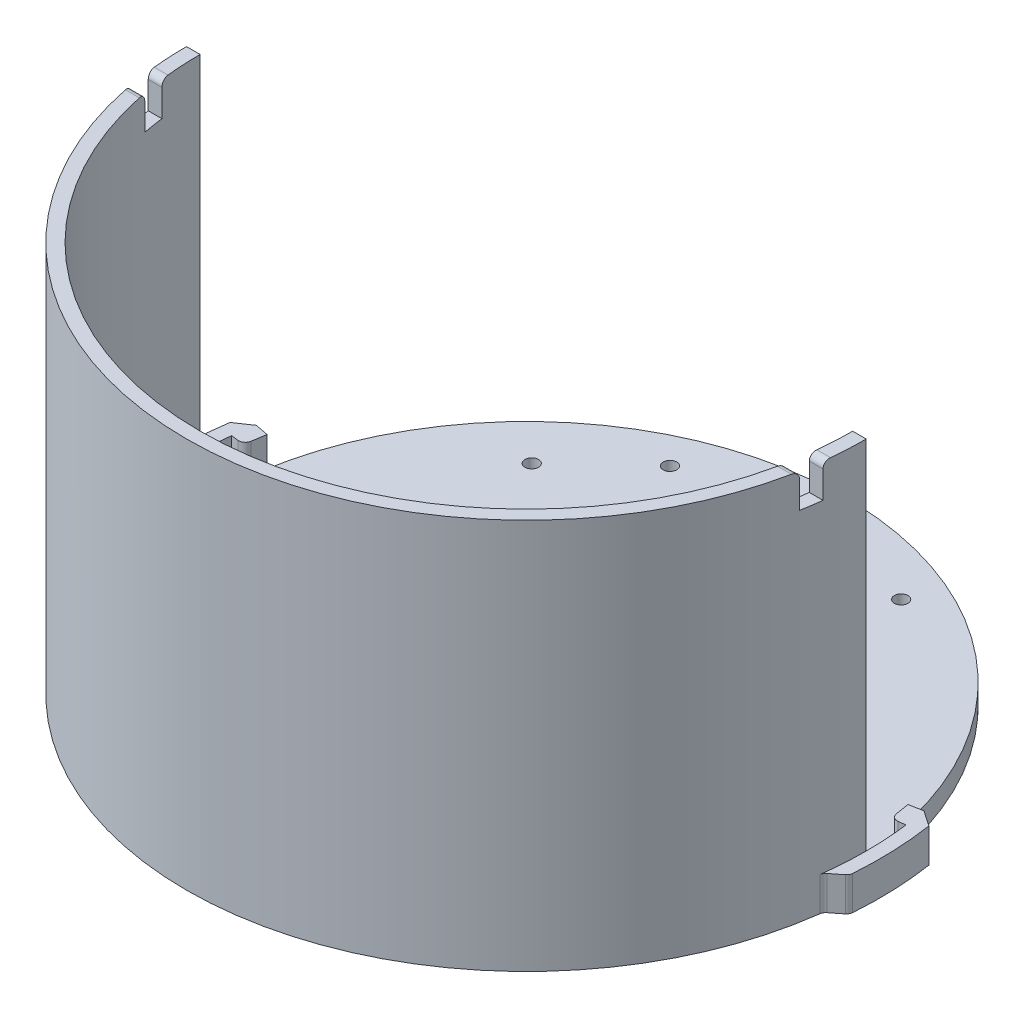
from build123d import *

# Parameters (mm, degrees)
A_BASE_T_START         = -1.5
A_BASE_T_OUTLINE_R     = 47
A_BASE_T_OUTLINE_R_2   = 1
A_BASE_T_DEPTH         = 3
SHELL_BODY_DEPTH       = 57.5
SKETCH3_W              = 2.489993647
SKETCH3_H              = 3
CLIP_CAVITY_DEPTH      = 5
CLIP_DEPTH             = 5
TOP_CLAMP_DEPTH        = 5
CLIP_CHAMFER_SIZE      = 2
CONTOURING_R           = 1
INTERFACE_CONTOURING_R = 2


with BuildPart() as part:
    # a_base_t: read off the stored shape, not the designer's step
    # a_base_t outline → a_base_t (new body)
    with BuildSketch(Plane(origin=(0, 0, 0), x_dir=(1, 0, 0), z_dir=(0, 1, 0)).offset(A_BASE_T_START)):
        Circle(A_BASE_T_OUTLINE_R)
        with Locations((-17.009259258, -38.128042167)):
            Circle(A_BASE_T_OUTLINE_R_2, mode=Mode.SUBTRACT)
        with Locations((-9.166666665, -28.284271247)):
            Circle(A_BASE_T_OUTLINE_R_2, mode=Mode.SUBTRACT)
        with Locations((17.009259258, -38.128042167)):
            Circle(A_BASE_T_OUTLINE_R_2, mode=Mode.SUBTRACT)
        with Locations((27.5, -28.284271247)):
            Circle(A_BASE_T_OUTLINE_R_2, mode=Mode.SUBTRACT)
        with Locations((-27.5, 28.284271247)):
            Circle(A_BASE_T_OUTLINE_R_2, mode=Mode.SUBTRACT)
        with Locations((-17.009259258, 38.128042167)):
            Circle(A_BASE_T_OUTLINE_R_2, mode=Mode.SUBTRACT)
        with Locations((9.166666665, 28.284271247)):
            Circle(A_BASE_T_OUTLINE_R_2, mode=Mode.SUBTRACT)
        with Locations((17.009259258, 38.128042167)):
            Circle(A_BASE_T_OUTLINE_R_2, mode=Mode.SUBTRACT)
    extrude(amount=A_BASE_T_DEPTH)


with BuildPart() as body_2:
    # Sketch1 → Shell Body (new body)
    with BuildSketch(Plane(origin=(0, 0, 0), x_dir=(1, 0, 0), z_dir=(0, 1, 0))):
        with BuildLine():
            Line((-50, 0), (-48, 0))
            ThreePointArc((-48, 0), (0, -48), (48, 0))
            Line((48, 0), (50, 0))
            ThreePointArc((50, 0), (0, -50), (-50, 0))
        make_face()
    extrude(amount=SHELL_BODY_DEPTH)

    # Sketch3 → Clip Cavity (cut)
    with BuildSketch(Plane(origin=(0, 57.5, 0), x_dir=(1, 0, 0), z_dir=(0, 1, 0))):
        with Locations((48.393697761, -7.5)):
            Rectangle(SKETCH3_W, SKETCH3_H)
        with Locations((-48.393697761, -7.5)):
            Rectangle(SKETCH3_W, SKETCH3_H)
    extrude(amount=-CLIP_CAVITY_DEPTH, mode=Mode.SUBTRACT)

    # Sketch4 → Clip (add)
    with BuildSketch(Plane.XZ):
        with BuildLine():
            Line((47.148700937, -9), (51.077759348, -9.75))
            ThreePointArc((51.077759348, -9.75), (51.969657629, -1.776143553), (51.624242367, 6.24))
            Line((51.624242367, 6.24), (49.638694584, 6))
            ThreePointArc((49.638694584, 6), (49.90959191, 3.005434312), (50, 0))
            ThreePointArc((50, 0), (49.901862962, -3.131145627), (49.607837082, -6.25))
            Line((49.607837082, -6.25), (47.623523599, -6))
            Line((47.623523599, -6), (47.148700937, -9))
        make_face()
        with BuildLine():
            ThreePointArc((-50, 0), (-49.90959191, 3.005434312), (-49.638694584, 6))
            Line((-49.638694584, 6), (-51.624242367, 6.24))
            ThreePointArc((-51.624242367, 6.24), (-51.969657629, -1.776143553), (-51.077759348, -9.75))
            Line((-51.077759348, -9.75), (-47.148700937, -9))
            Line((-47.148700937, -9), (-47.623523599, -6))
            Line((-47.623523599, -6), (-49.607837082, -6.25))
            ThreePointArc((-49.607837082, -6.25), (-49.901862962, -3.131145627), (-50, 0))
        make_face()
    extrude(amount=-CLIP_DEPTH)

    # Sketch5 → Top Clamp (add)
    with BuildSketch(Plane.XZ):
        with BuildLine():
            Line((16, 45.254833996), (16, 36))
            Line((16, 36), (11.773805672, 36))
            ThreePointArc((11.773805672, 36), (0, 45.15), (-11.773805672, 36))
            Line((-11.773805672, 36), (-16, 36))
            Line((-16, 36), (-16, 45.254833996))
            ThreePointArc((-16, 45.254833996), (0, 48), (16, 45.254833996))
        make_face()
    extrude(amount=-TOP_CLAMP_DEPTH)

    # Clip Chamfer
    # the kernel refuses this chamfer: 2 mm, written as the material it takes off along each edge
    with BuildSketch(Plane(origin=(-51.624242367, -5.143365976, 6.24), x_dir=(0.9927738916792685, 0, -0.11999999999999984), z_dir=(0, 1, 0))) as clip_chamfer_piece_1_section:
        with BuildLine():
            Line((CLIP_CHAMFER_SIZE, 0), (0.037062475, 1.962937525))
            ThreePointArc((0.037062475, 1.962937525), (0.009797411, 1.009373468), (0, 0))
            Line((0, 0), (CLIP_CHAMFER_SIZE, 0))
        make_face()
    clip_chamfer_piece_1 = extrude(amount=15.286731952, mode=Mode.PRIVATE)
    clip_chamfer_piece_1 = clip_chamfer_piece_1 - Plane(origin=(0, -5.143365976, 0), x_dir=(1, 0, 0), z_dir=(0, -1, 0)) * Cylinder(50, 39, mode=Mode.PRIVATE)
    add(clip_chamfer_piece_1, mode=Mode.SUBTRACT)
    with BuildSketch(Plane(origin=(-51.077759348, -5.143365976, -9.75), x_dir=(-0.1689236286537023, 0, 0.9856291430768807), z_dir=(0, 1, 0))) as clip_chamfer_piece_2:
        with BuildLine():
            Line((1.963287385, 0), (CLIP_CHAMFER_SIZE * 0.0188777633164, CLIP_CHAMFER_SIZE * 0.999821799148))
            Line((CLIP_CHAMFER_SIZE * 0.0188777633164, CLIP_CHAMFER_SIZE * 0.999821799148), (0, 0))
            ThreePointArc((0, 0), (1.00937855, -0.009259048), (1.963287385, 0))
        make_face()
    extrude(amount=15.286731952, mode=Mode.SUBTRACT)
    with BuildSketch(Plane(origin=(51.077759348, -5.143365976, -9.75), x_dir=(-0.9822646028438573, 0, 0.18749999999999856), z_dir=(0, 1, 0))) as clip_chamfer_piece_3:
        with BuildLine():
            Line((CLIP_CHAMFER_SIZE, 0), (0.037062475, 1.962937525))
            ThreePointArc((0.037062475, 1.962937525), (0.009797411, 1.009373468), (0, 0))
            Line((0, 0), (CLIP_CHAMFER_SIZE, 0))
        make_face()
    extrude(amount=15.286731952, mode=Mode.SUBTRACT)
    with BuildSketch(Plane(origin=(51.624242367, -5.143365976, 6.24), x_dir=(-0.9927738916792685, 0, -0.12000000000000073), z_dir=(0, 1, 0))) as clip_chamfer_piece_4_section:
        with BuildLine():
            Line((CLIP_CHAMFER_SIZE, 0), (0.037062475, -1.962937525))
            ThreePointArc((0.037062475, -1.962937525), (0.009797411, -1.009373468), (0, 0))
            Line((0, 0), (CLIP_CHAMFER_SIZE, 0))
        make_face()
    clip_chamfer_piece_4 = extrude(amount=15.286731952, mode=Mode.PRIVATE)
    clip_chamfer_piece_4 = clip_chamfer_piece_4 - Plane(origin=(0, -5.143365976, 0), x_dir=(1, 0, 0), z_dir=(0, -1, 0)) * Cylinder(50, 39, mode=Mode.PRIVATE)
    add(clip_chamfer_piece_4, mode=Mode.SUBTRACT)

    # Contouring
    # the kernel refuses this fillet: 1 mm, written as the material it adds along each edge
    with BuildSketch(Plane(origin=(-49.638694584, 0, 6), x_dir=(0.12404711519579938, 0, 0.9922763290594007), z_dir=(0, 1, 0))) as contouring_piece_1:
        with BuildLine():
            CenterArc((0.41183536, -0.999991687), CONTOURING_R, 90.233628647, 44.532742706)
            Line((-0.29238226, -0.290007501), (0, 0))
            ThreePointArc((0, 0), (0.203878891, -0.000415668), (0.407757782, 0))
        make_face()
    extrude(amount=5)
    with BuildSketch(Plane(origin=(49.638694584, 0, 6), x_dir=(-0.12404711519576721, 0, 0.9922763290594048), z_dir=(0, 1, 0))) as contouring_piece_2:
        with BuildLine():
            CenterArc((0.41183536, 0.999991687), CONTOURING_R, 225.233628647, 44.532742706)
            Line((-0.29238226, 0.290007501), (0, 0))
            ThreePointArc((0, 0), (0.203878891, 0.000415668), (0.407757782, 0))
        make_face()
    extrude(amount=5)
    # the kernel refuses this fillet: 1 mm, written as the material it takes off along each edge
    with BuildSketch(Plane(origin=(-51.823000213, -1.108298517, 4.286799377), x_dir=(-0.07818952348583504, 0, -0.9969385128567649), z_dir=(0, 1, 0))) as contouring_2_piece_1:
        with BuildLine():
            CenterArc((0.43905672, -0.999990915), CONTOURING_R, 89.755765309, 47.651830218)
            Line((-0.297130092, -0.323212533), (0, 0))
            ThreePointArc((0, 0), (0.221659703, 0.000472435), (0.443319407, 0))
        make_face()
    extrude(amount=7.216597034, mode=Mode.SUBTRACT)
    with BuildSketch(Plane(origin=(-47.623523599, -2.422115112, -6), x_dir=(-0.9921567416492214, 0, -0.12500000000000036), z_dir=(0, 1, 0))) as contouring_2_piece_2:
        with BuildLine():
            CenterArc((CONTOURING_R * 0.968846044958, -CONTOURING_R), CONTOURING_R, 90, 88.186916453)
            Line((-CONTOURING_R * 0.0306533166715, -CONTOURING_R * 0.968361003452), (0, 0))
            Line((0, 0), (CONTOURING_R * 0.968846044958, 0))
        make_face()
    extrude(amount=9.844230225, mode=Mode.SUBTRACT)
    with BuildSketch(Plane(origin=(47.623523599, -2.422115112, -6), x_dir=(0.9921567416492214, 0, -0.12500000000000036), z_dir=(0, 1, 0))) as contouring_2_piece_3:
        with BuildLine():
            CenterArc((CONTOURING_R * 0.968846044958, CONTOURING_R), CONTOURING_R, 181.813083547, 88.186916453)
            Line((-CONTOURING_R * 0.0306533166715, CONTOURING_R * 0.968361003452), (0, 0))
            Line((0, 0), (CONTOURING_R * 0.968846044958, 0))
        make_face()
    extrude(amount=9.844230225, mode=Mode.SUBTRACT)
    with BuildSketch(Plane(origin=(51.823000213, -1.108298517, 4.286799377), x_dir=(-0.7868499647334531, 0, 0.6171443372493695), z_dir=(0, 1, 0))) as contouring_2_piece_4:
        with BuildLine():
            CenterArc((0.439036027, -1), CONTOURING_R, 90, 47.651830218)
            ThreePointArc((-0.300028991, -0.326365901), (-0.150362296, -0.162863217), (0, 0))
            Line((0, 0), (0.439036027, 0))
        make_face()
    extrude(amount=7.216597034, mode=Mode.SUBTRACT)
    with BuildSketch(Plane(origin=(-52.138694584, 57.5, 6), x_dir=(0, -1, 0), z_dir=(1, 0, 0)), Plane(origin=(52.138694584, 57.5, 6), x_dir=(0, 0, -1), z_dir=(-1, 0, 0))) as contouring_2_piece_5:
        with BuildLine():
            CenterArc((CONTOURING_R, CONTOURING_R), CONTOURING_R, 180, 90)
            Line((0, CONTOURING_R), (0, 0))
            Line((0, 0), (CONTOURING_R, 0))
        make_face()
    extrude(amount=7.015170985, mode=Mode.SUBTRACT)
    with BuildSketch(Plane(origin=(-44.648700937, 57.5, 9), x_dir=(0, 0, 1), z_dir=(-1, 0, 0)), Plane(origin=(44.648700937, 57.5, 9), x_dir=(0, -1, 0), z_dir=(1, 0, 0))) as contouring_2_piece_6:
        with BuildLine():
            CenterArc((CONTOURING_R, -CONTOURING_R), CONTOURING_R, 90, 90)
            Line((0, -CONTOURING_R), (0, 0))
            Line((0, 0), (CONTOURING_R, 0))
        make_face()
    extrude(amount=7.034629573, mode=Mode.SUBTRACT)

    # Interface Contouring
    interface_contouring_edges = [body_2.edges().sort_by_distance(p)[0] for p in [
        (-16, 2.5, 45.254833996),
        (16, 2.5, 45.254833996),
        (16, 2.5, 36),
        (11.773805672, 2.5, 36),
        (-11.773805672, 2.5, 36),
        (-16, 2.5, 36),
    ]]
    fillet(interface_contouring_edges, radius=INTERFACE_CONTOURING_R)


solid = Compound([part.part, body_2.part])
